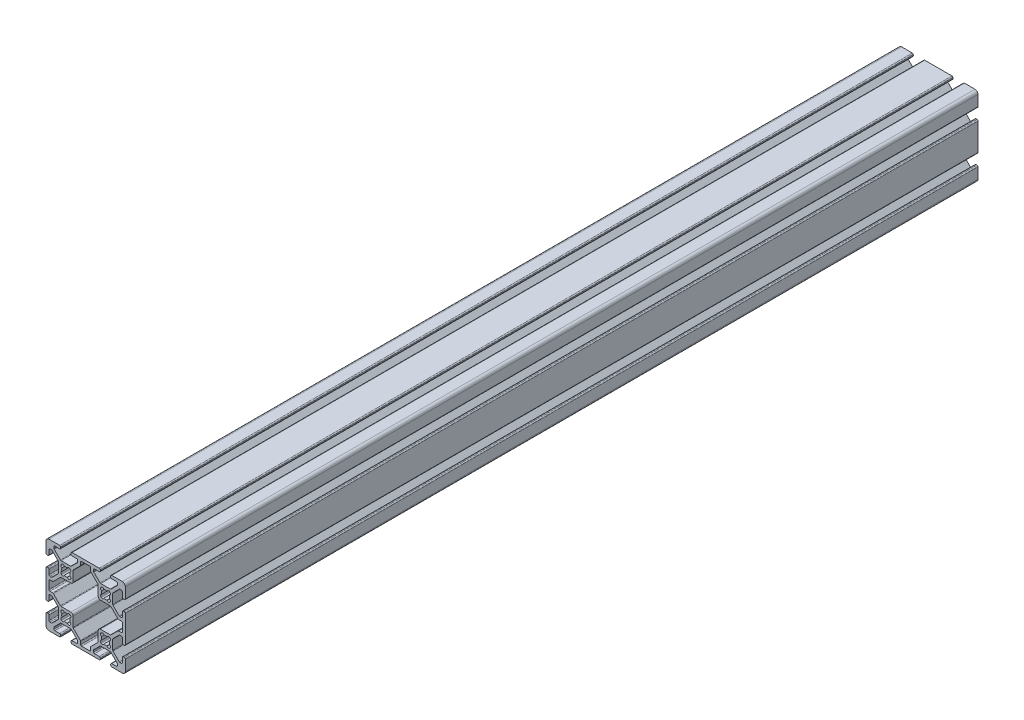
from build123d import *

# Parameters (mm, degrees)
EXTRUDE1_DEPTH = 430


with BuildPart() as part:
    # Sketch1 → Extrude1 (new body)
    with BuildSketch(Plane.XY):
        with BuildLine():
            Line((-22.383919339, -3.655), (-17.616080661, -3.655))
            ThreePointArc((-17.616080661, -3.655), (-17.421677478, -3.693669197), (-17.256870417, -3.803789755))
            Line((-17.256870417, -3.803789755), (-14.153789755, -6.906870417))
            ThreePointArc((-14.153789755, -6.906870417), (-14.043669197, -7.071677478), (-14.005, -7.266080661))
            Line((-14.005, -7.266080661), (-14.005, -7.992))
            ThreePointArc((-14.005, -7.992), (-14.153789755, -8.351210245), (-14.513, -8.5))
            Line((-14.513, -8.5), (-16.862, -8.5))
            ThreePointArc((-16.862, -8.5), (-17.221210245, -8.648789755), (-17.37, -9.008))
            Line((-17.37, -9.008), (-17.37, -9.492))
            ThreePointArc((-17.37, -9.492), (-17.221210245, -9.851210245), (-16.862, -10))
            Line((-16.862, -10), (-3.138, -10))
            ThreePointArc((-3.138, -10), (-2.778789755, -9.851210245), (-2.63, -9.492))
            Line((-2.63, -9.492), (-2.63, -9.008))
            ThreePointArc((-2.63, -9.008), (-2.778789755, -8.648789755), (-3.138, -8.5))
            Line((-3.138, -8.5), (-5.487, -8.5))
            ThreePointArc((-5.487, -8.5), (-5.846210245, -8.351210245), (-5.995, -7.992))
            Line((-5.995, -7.992), (-5.995, -7.266080661))
            ThreePointArc((-5.995, -7.266080661), (-5.956330803, -7.071677478), (-5.846210245, -6.906870417))
            Line((-5.846210245, -6.906870417), (-2.743129583, -3.803789755))
            ThreePointArc((-2.743129583, -3.803789755), (-2.578322522, -3.693669197), (-2.383919339, -3.655))
            Line((-2.383919339, -3.655), (2.383919339, -3.655))
            ThreePointArc((2.383919339, -3.655), (2.578322522, -3.693669197), (2.743129583, -3.803789755))
            Line((2.743129583, -3.803789755), (5.846210245, -6.906870417))
            ThreePointArc((5.846210245, -6.906870417), (5.956330803, -7.071677478), (5.995, -7.266080661))
            Line((5.995, -7.266080661), (5.995, -7.992))
            ThreePointArc((5.995, -7.992), (5.846210245, -8.351210245), (5.487, -8.5))
            Line((5.487, -8.5), (3.138, -8.5))
            ThreePointArc((3.138, -8.5), (2.778789755, -8.648789755), (2.63, -9.008))
            Line((2.63, -9.008), (2.63, -9.492))
            ThreePointArc((2.63, -9.492), (2.778789755, -9.851210245), (3.138, -10))
            Line((3.138, -10), (8.5, -10))
            ThreePointArc((8.5, -10), (9.560660172, -9.560660172), (10, -8.5))
            Line((10, -8.5), (10, -3.138))
            ThreePointArc((10, -3.138), (9.851210245, -2.778789755), (9.492, -2.63))
            Line((9.492, -2.63), (9.008, -2.63))
            ThreePointArc((9.008, -2.63), (8.648789755, -2.778789755), (8.5, -3.138))
            Line((8.5, -3.138), (8.5, -5.487))
            ThreePointArc((8.5, -5.487), (8.351210245, -5.846210245), (7.992, -5.995))
            Line((7.992, -5.995), (7.266080661, -5.995))
            ThreePointArc((7.266080661, -5.995), (7.071677478, -5.956330803), (6.906870417, -5.846210245))
            Line((6.906870417, -5.846210245), (3.803789755, -2.743129583))
            ThreePointArc((3.803789755, -2.743129583), (3.693669197, -2.578322522), (3.655, -2.383919339))
            Line((3.655, -2.383919339), (3.655, 2.383919339))
            ThreePointArc((3.655, 2.383919339), (3.693669197, 2.578322522), (3.803789755, 2.743129583))
            Line((3.803789755, 2.743129583), (6.906870417, 5.846210245))
            ThreePointArc((6.906870417, 5.846210245), (7.071677478, 5.956330803), (7.266080661, 5.995))
            Line((7.266080661, 5.995), (7.992, 5.995))
            ThreePointArc((7.992, 5.995), (8.351210245, 5.846210245), (8.5, 5.487))
            Line((8.5, 5.487), (8.5, 3.138))
            ThreePointArc((8.5, 3.138), (8.648789755, 2.778789755), (9.008, 2.63))
            Line((9.008, 2.63), (9.492, 2.63))
            ThreePointArc((9.492, 2.63), (9.851210245, 2.778789755), (10, 3.138))
            Line((10, 3.138), (10, 16.862))
            ThreePointArc((10, 16.862), (9.851210245, 17.221210245), (9.492, 17.37))
            Line((9.492, 17.37), (9.008, 17.37))
            ThreePointArc((9.008, 17.37), (8.648789755, 17.221210245), (8.5, 16.862))
            Line((8.5, 16.862), (8.5, 14.513))
            ThreePointArc((8.5, 14.513), (8.351210245, 14.153789755), (7.992, 14.005))
            Line((7.992, 14.005), (7.266080661, 14.005))
            ThreePointArc((7.266080661, 14.005), (7.071677478, 14.043669197), (6.906870417, 14.153789755))
            Line((6.906870417, 14.153789755), (3.803789755, 17.256870417))
            ThreePointArc((3.803789755, 17.256870417), (3.693669197, 17.421677478), (3.655, 17.616080661))
            Line((3.655, 17.616080661), (3.655, 22.383919339))
            ThreePointArc((3.655, 22.383919339), (3.693669197, 22.578322522), (3.803789755, 22.743129583))
            Line((3.803789755, 22.743129583), (6.906870417, 25.846210245))
            ThreePointArc((6.906870417, 25.846210245), (7.071677478, 25.956330803), (7.266080661, 25.995))
            Line((7.266080661, 25.995), (7.992, 25.995))
            ThreePointArc((7.992, 25.995), (8.351210245, 25.846210245), (8.5, 25.487))
            Line((8.5, 25.487), (8.5, 23.138))
            ThreePointArc((8.5, 23.138), (8.648789755, 22.778789755), (9.008, 22.63))
            Line((9.008, 22.63), (9.492, 22.63))
            ThreePointArc((9.492, 22.63), (9.851210245, 22.778789755), (10, 23.138))
            Line((10, 23.138), (10, 28.5))
            ThreePointArc((10, 28.5), (9.560660172, 29.560660172), (8.5, 30))
            Line((8.5, 30), (3.138, 30))
            ThreePointArc((3.138, 30), (2.778789755, 29.851210245), (2.63, 29.492))
            Line((2.63, 29.492), (2.63, 29.008))
            ThreePointArc((2.63, 29.008), (2.778789755, 28.648789755), (3.138, 28.5))
            Line((3.138, 28.5), (5.487, 28.5))
            ThreePointArc((5.487, 28.5), (5.846210245, 28.351210245), (5.995, 27.992))
            Line((5.995, 27.992), (5.995, 27.266080661))
            ThreePointArc((5.995, 27.266080661), (5.956330803, 27.071677478), (5.846210245, 26.906870417))
            Line((5.846210245, 26.906870417), (2.743129583, 23.803789755))
            ThreePointArc((2.743129583, 23.803789755), (2.578322522, 23.693669197), (2.383919339, 23.655))
            Line((2.383919339, 23.655), (-2.383919339, 23.655))
            ThreePointArc((-2.383919339, 23.655), (-2.578322522, 23.693669197), (-2.743129583, 23.803789755))
            Line((-2.743129583, 23.803789755), (-5.846210245, 26.906870417))
            ThreePointArc((-5.846210245, 26.906870417), (-5.956330803, 27.071677478), (-5.995, 27.266080661))
            Line((-5.995, 27.266080661), (-5.995, 27.992))
            ThreePointArc((-5.995, 27.992), (-5.846210245, 28.351210245), (-5.487, 28.5))
            Line((-5.487, 28.5), (-3.138, 28.5))
            ThreePointArc((-3.138, 28.5), (-2.778789755, 28.648789755), (-2.63, 29.008))
            Line((-2.63, 29.008), (-2.63, 29.492))
            ThreePointArc((-2.63, 29.492), (-2.778789755, 29.851210245), (-3.138, 30))
            Line((-3.138, 30), (-16.862, 30))
            ThreePointArc((-16.862, 30), (-17.221210245, 29.851210245), (-17.37, 29.492))
            Line((-17.37, 29.492), (-17.37, 29.008))
            ThreePointArc((-17.37, 29.008), (-17.221210245, 28.648789755), (-16.862, 28.5))
            Line((-16.862, 28.5), (-14.513, 28.5))
            ThreePointArc((-14.513, 28.5), (-14.153789755, 28.351210245), (-14.005, 27.992))
            Line((-14.005, 27.992), (-14.005, 27.266080661))
            ThreePointArc((-14.005, 27.266080661), (-14.043669197, 27.071677478), (-14.153789755, 26.906870417))
            Line((-14.153789755, 26.906870417), (-17.256870417, 23.803789755))
            ThreePointArc((-17.256870417, 23.803789755), (-17.421677478, 23.693669197), (-17.616080661, 23.655))
            Line((-17.616080661, 23.655), (-22.383919339, 23.655))
            ThreePointArc((-22.383919339, 23.655), (-22.578322522, 23.693669197), (-22.743129583, 23.803789755))
            Line((-22.743129583, 23.803789755), (-25.846210245, 26.906870417))
            ThreePointArc((-25.846210245, 26.906870417), (-25.956330803, 27.071677478), (-25.995, 27.266080661))
            Line((-25.995, 27.266080661), (-25.995, 27.992))
            ThreePointArc((-25.995, 27.992), (-25.846210245, 28.351210245), (-25.487, 28.5))
            Line((-25.487, 28.5), (-23.138, 28.5))
            ThreePointArc((-23.138, 28.5), (-22.778789755, 28.648789755), (-22.63, 29.008))
            Line((-22.63, 29.008), (-22.63, 29.492))
            ThreePointArc((-22.63, 29.492), (-22.778789755, 29.851210245), (-23.138, 30))
            Line((-23.138, 30), (-28.5, 30))
            ThreePointArc((-28.5, 30), (-29.560660172, 29.560660172), (-30, 28.5))
            Line((-30, 28.5), (-30, 23.138))
            ThreePointArc((-30, 23.138), (-29.851210245, 22.778789755), (-29.492, 22.63))
            Line((-29.492, 22.63), (-29.008, 22.63))
            ThreePointArc((-29.008, 22.63), (-28.648789755, 22.778789755), (-28.5, 23.138))
            Line((-28.5, 23.138), (-28.5, 25.487))
            ThreePointArc((-28.5, 25.487), (-28.351210245, 25.846210245), (-27.992, 25.995))
            Line((-27.992, 25.995), (-27.266080661, 25.995))
            ThreePointArc((-27.266080661, 25.995), (-27.071677478, 25.956330803), (-26.906870417, 25.846210245))
            Line((-26.906870417, 25.846210245), (-23.803789755, 22.743129583))
            ThreePointArc((-23.803789755, 22.743129583), (-23.693669197, 22.578322522), (-23.655, 22.383919339))
            Line((-23.655, 22.383919339), (-23.655, 17.616080661))
            ThreePointArc((-23.655, 17.616080661), (-23.693669197, 17.421677478), (-23.803789755, 17.256870417))
            Line((-23.803789755, 17.256870417), (-26.906870417, 14.153789755))
            ThreePointArc((-26.906870417, 14.153789755), (-27.071677478, 14.043669197), (-27.266080661, 14.005))
            Line((-27.266080661, 14.005), (-27.992, 14.005))
            ThreePointArc((-27.992, 14.005), (-28.351210245, 14.153789755), (-28.5, 14.513))
            Line((-28.5, 14.513), (-28.5, 16.862))
            ThreePointArc((-28.5, 16.862), (-28.648789755, 17.221210245), (-29.008, 17.37))
            Line((-29.008, 17.37), (-29.492, 17.37))
            ThreePointArc((-29.492, 17.37), (-29.851210245, 17.221210245), (-30, 16.862))
            Line((-30, 16.862), (-30, 3.138))
            ThreePointArc((-30, 3.138), (-29.851210245, 2.778789755), (-29.492, 2.63))
            Line((-29.492, 2.63), (-29.008, 2.63))
            ThreePointArc((-29.008, 2.63), (-28.648789755, 2.778789755), (-28.5, 3.138))
            Line((-28.5, 3.138), (-28.5, 5.487))
            ThreePointArc((-28.5, 5.487), (-28.351210245, 5.846210245), (-27.992, 5.995))
            Line((-27.992, 5.995), (-27.266080661, 5.995))
            ThreePointArc((-27.266080661, 5.995), (-27.071677478, 5.956330803), (-26.906870417, 5.846210245))
            Line((-26.906870417, 5.846210245), (-23.803789755, 2.743129583))
            ThreePointArc((-23.803789755, 2.743129583), (-23.693669197, 2.578322522), (-23.655, 2.383919339))
            Line((-23.655, 2.383919339), (-23.655, -2.383919339))
            ThreePointArc((-23.655, -2.383919339), (-23.693669197, -2.578322522), (-23.803789755, -2.743129583))
            Line((-23.803789755, -2.743129583), (-26.906870417, -5.846210245))
            ThreePointArc((-26.906870417, -5.846210245), (-27.071677478, -5.956330803), (-27.266080661, -5.995))
            Line((-27.266080661, -5.995), (-27.992, -5.995))
            ThreePointArc((-27.992, -5.995), (-28.351210245, -5.846210245), (-28.5, -5.487))
            Line((-28.5, -5.487), (-28.5, -3.138))
            ThreePointArc((-28.5, -3.138), (-28.648789755, -2.778789755), (-29.008, -2.63))
            Line((-29.008, -2.63), (-29.492, -2.63))
            ThreePointArc((-29.492, -2.63), (-29.851210245, -2.778789755), (-30, -3.138))
            Line((-30, -3.138), (-30, -8.5))
            ThreePointArc((-30, -8.5), (-29.560660172, -9.560660172), (-28.5, -10))
            Line((-28.5, -10), (-23.138, -10))
            ThreePointArc((-23.138, -10), (-22.778789755, -9.851210245), (-22.63, -9.492))
            Line((-22.63, -9.492), (-22.63, -9.008))
            ThreePointArc((-22.63, -9.008), (-22.778789755, -8.648789755), (-23.138, -8.5))
            Line((-23.138, -8.5), (-25.487, -8.5))
            ThreePointArc((-25.487, -8.5), (-25.846210245, -8.351210245), (-25.995, -7.992))
            Line((-25.995, -7.992), (-25.995, -7.266080661))
            ThreePointArc((-25.995, -7.266080661), (-25.956330803, -7.071677478), (-25.846210245, -6.906870417))
            Line((-25.846210245, -6.906870417), (-22.743129583, -3.803789755))
            ThreePointArc((-22.743129583, -3.803789755), (-22.578322522, -3.693669197), (-22.383919339, -3.655))
        make_face()
        with BuildLine():
            Line((-2.124900844, 17.695494034), (-2.304505966, 17.875099156))
            ThreePointArc((-2.304505966, 17.875099156), (-2.505938017, 18.643532189), (-1.935133506, 19.196023282))
            ThreePointArc((-1.935133506, 19.196023282), (-2.0955, 20), (-1.935133506, 20.803976718))
            ThreePointArc((-1.935133506, 20.803976718), (-2.505938017, 21.356467811), (-2.304505966, 22.124900844))
            Line((-2.304505966, 22.124900844), (-2.124900844, 22.304505966))
            ThreePointArc((-2.124900844, 22.304505966), (-1.356467811, 22.505938017), (-0.803976718, 21.935133506))
            ThreePointArc((-0.803976718, 21.935133506), (0, 22.0955), (0.803976718, 21.935133506))
            ThreePointArc((0.803976718, 21.935133506), (1.356467811, 22.505938017), (2.124900844, 22.304505966))
            Line((2.124900844, 22.304505966), (2.304505966, 22.124900844))
            ThreePointArc((2.304505966, 22.124900844), (2.505938017, 21.356467811), (1.935133506, 20.803976718))
            ThreePointArc((1.935133506, 20.803976718), (2.0955, 20), (1.935133506, 19.196023282))
            ThreePointArc((1.935133506, 19.196023282), (2.505938017, 18.643532189), (2.304505966, 17.875099156))
            Line((2.304505966, 17.875099156), (2.124900844, 17.695494034))
            ThreePointArc((2.124900844, 17.695494034), (1.356467811, 17.494061983), (0.803976718, 18.064866494))
            ThreePointArc((0.803976718, 18.064866494), (0, 17.9045), (-0.803976718, 18.064866494))
            ThreePointArc((-0.803976718, 18.064866494), (-1.356467811, 17.494061983), (-2.124900844, 17.695494034))
        make_face(mode=Mode.SUBTRACT)
        with BuildLine():
            Line((-22.124900844, 17.695494034), (-22.304505966, 17.875099156))
            ThreePointArc((-22.304505966, 17.875099156), (-22.505938017, 18.643532189), (-21.935133506, 19.196023282))
            ThreePointArc((-21.935133506, 19.196023282), (-22.0955, 20), (-21.935133506, 20.803976718))
            ThreePointArc((-21.935133506, 20.803976718), (-22.505938017, 21.356467811), (-22.304505966, 22.124900844))
            Line((-22.304505966, 22.124900844), (-22.124900844, 22.304505966))
            ThreePointArc((-22.124900844, 22.304505966), (-21.356467811, 22.505938017), (-20.803976718, 21.935133506))
            ThreePointArc((-20.803976718, 21.935133506), (-20, 22.0955), (-19.196023282, 21.935133506))
            ThreePointArc((-19.196023282, 21.935133506), (-18.643532189, 22.505938017), (-17.875099156, 22.304505966))
            Line((-17.875099156, 22.304505966), (-17.695494034, 22.124900844))
            ThreePointArc((-17.695494034, 22.124900844), (-17.494061983, 21.356467811), (-18.064866494, 20.803976718))
            ThreePointArc((-18.064866494, 20.803976718), (-17.9045, 20), (-18.064866494, 19.196023282))
            ThreePointArc((-18.064866494, 19.196023282), (-17.494061983, 18.643532189), (-17.695494034, 17.875099156))
            Line((-17.695494034, 17.875099156), (-17.875099156, 17.695494034))
            ThreePointArc((-17.875099156, 17.695494034), (-18.643532189, 17.494061983), (-19.196023282, 18.064866494))
            ThreePointArc((-19.196023282, 18.064866494), (-20, 17.9045), (-20.803976718, 18.064866494))
            ThreePointArc((-20.803976718, 18.064866494), (-21.356467811, 17.494061983), (-22.124900844, 17.695494034))
        make_face(mode=Mode.SUBTRACT)
        with BuildLine():
            Line((-2.124900844, -2.304505966), (-2.304505966, -2.124900844))
            ThreePointArc((-2.304505966, -2.124900844), (-2.505938017, -1.356467811), (-1.935133506, -0.803976718))
            ThreePointArc((-1.935133506, -0.803976718), (-2.0955, 0), (-1.935133506, 0.803976718))
            ThreePointArc((-1.935133506, 0.803976718), (-2.505938017, 1.356467811), (-2.304505966, 2.124900844))
            Line((-2.304505966, 2.124900844), (-2.124900844, 2.304505966))
            ThreePointArc((-2.124900844, 2.304505966), (-1.356467811, 2.505938017), (-0.803976718, 1.935133506))
            ThreePointArc((-0.803976718, 1.935133506), (0, 2.0955), (0.803976718, 1.935133506))
            ThreePointArc((0.803976718, 1.935133506), (1.356467811, 2.505938017), (2.124900844, 2.304505966))
            Line((2.124900844, 2.304505966), (2.304505966, 2.124900844))
            ThreePointArc((2.304505966, 2.124900844), (2.505938017, 1.356467811), (1.935133506, 0.803976718))
            ThreePointArc((1.935133506, 0.803976718), (2.0955, 0), (1.935133506, -0.803976718))
            ThreePointArc((1.935133506, -0.803976718), (2.505938017, -1.356467811), (2.304505966, -2.124900844))
            Line((2.304505966, -2.124900844), (2.124900844, -2.304505966))
            ThreePointArc((2.124900844, -2.304505966), (1.356467811, -2.505938017), (0.803976718, -1.935133506))
            ThreePointArc((0.803976718, -1.935133506), (0, -2.0955), (-0.803976718, -1.935133506))
            ThreePointArc((-0.803976718, -1.935133506), (-1.356467811, -2.505938017), (-2.124900844, -2.304505966))
        make_face(mode=Mode.SUBTRACT)
        with BuildLine():
            Line((-12.505, -7.992), (-12.505, -6.644760318))
            ThreePointArc((-12.505, -6.644760318), (-12.543669197, -6.450357134), (-12.653789755, -6.285550073))
            Line((-12.653789755, -6.285550073), (-16.196210245, -2.743129583))
            ThreePointArc((-16.196210245, -2.743129583), (-16.306330803, -2.578322522), (-16.345, -2.383919339))
            Line((-16.345, -2.383919339), (-16.345, 2.512))
            ThreePointArc((-16.345, 2.512), (-16.679776949, 3.320223051), (-17.488, 3.655))
            Line((-17.488, 3.655), (-22.383919339, 3.655))
            ThreePointArc((-22.383919339, 3.655), (-22.578322522, 3.693669197), (-22.743129583, 3.803789755))
            Line((-22.743129583, 3.803789755), (-26.285550073, 7.346210245))
            ThreePointArc((-26.285550073, 7.346210245), (-26.450357134, 7.456330803), (-26.644760318, 7.495))
            Line((-26.644760318, 7.495), (-27.992, 7.495))
            ThreePointArc((-27.992, 7.495), (-28.351210245, 7.643789755), (-28.5, 8.003))
            Line((-28.5, 8.003), (-28.5, 11.997))
            ThreePointArc((-28.5, 11.997), (-28.351210245, 12.356210245), (-27.992, 12.505))
            Line((-27.992, 12.505), (-26.644760318, 12.505))
            ThreePointArc((-26.644760318, 12.505), (-26.450357134, 12.543669197), (-26.285550073, 12.653789755))
            Line((-26.285550073, 12.653789755), (-22.743129583, 16.196210245))
            ThreePointArc((-22.743129583, 16.196210245), (-22.578322522, 16.306330803), (-22.383919339, 16.345))
            Line((-22.383919339, 16.345), (-17.488, 16.345))
            ThreePointArc((-17.488, 16.345), (-16.679776949, 16.679776949), (-16.345, 17.488))
            Line((-16.345, 17.488), (-16.345, 22.383919339))
            ThreePointArc((-16.345, 22.383919339), (-16.306330803, 22.578322522), (-16.196210245, 22.743129583))
            Line((-16.196210245, 22.743129583), (-12.653789755, 26.285550073))
            ThreePointArc((-12.653789755, 26.285550073), (-12.543669197, 26.450357134), (-12.505, 26.644760318))
            Line((-12.505, 26.644760318), (-12.505, 27.992))
            ThreePointArc((-12.505, 27.992), (-12.356210245, 28.351210245), (-11.997, 28.5))
            Line((-11.997, 28.5), (-8.003, 28.5))
            ThreePointArc((-8.003, 28.5), (-7.643789755, 28.351210245), (-7.495, 27.992))
            Line((-7.495, 27.992), (-7.495, 26.644760318))
            ThreePointArc((-7.495, 26.644760318), (-7.456330803, 26.450357134), (-7.346210245, 26.285550073))
            Line((-7.346210245, 26.285550073), (-3.803789755, 22.743129583))
            ThreePointArc((-3.803789755, 22.743129583), (-3.693669197, 22.578322522), (-3.655, 22.383919339))
            Line((-3.655, 22.383919339), (-3.655, 17.488))
            ThreePointArc((-3.655, 17.488), (-3.320223051, 16.679776949), (-2.512, 16.345))
            Line((-2.512, 16.345), (2.383919339, 16.345))
            ThreePointArc((2.383919339, 16.345), (2.578322522, 16.306330803), (2.743129583, 16.196210245))
            Line((2.743129583, 16.196210245), (6.285550073, 12.653789755))
            ThreePointArc((6.285550073, 12.653789755), (6.450357134, 12.543669197), (6.644760318, 12.505))
            Line((6.644760318, 12.505), (7.992, 12.505))
            ThreePointArc((7.992, 12.505), (8.351210245, 12.356210245), (8.5, 11.997))
            Line((8.5, 11.997), (8.5, 8.003))
            ThreePointArc((8.5, 8.003), (8.351210245, 7.643789755), (7.992, 7.495))
            Line((7.992, 7.495), (6.644760318, 7.495))
            ThreePointArc((6.644760318, 7.495), (6.450357134, 7.456330803), (6.285550073, 7.346210245))
            Line((6.285550073, 7.346210245), (2.743129583, 3.803789755))
            ThreePointArc((2.743129583, 3.803789755), (2.578322522, 3.693669197), (2.383919339, 3.655))
            Line((2.383919339, 3.655), (-2.512, 3.655))
            ThreePointArc((-2.512, 3.655), (-3.320223051, 3.320223051), (-3.655, 2.512))
            Line((-3.655, 2.512), (-3.655, -2.383919339))
            ThreePointArc((-3.655, -2.383919339), (-3.693669197, -2.578322522), (-3.803789755, -2.743129583))
            Line((-3.803789755, -2.743129583), (-7.346210245, -6.285550073))
            ThreePointArc((-7.346210245, -6.285550073), (-7.456330803, -6.450357134), (-7.495, -6.644760318))
            Line((-7.495, -6.644760318), (-7.495, -7.992))
            ThreePointArc((-7.495, -7.992), (-7.643789755, -8.351210245), (-8.003, -8.5))
            Line((-8.003, -8.5), (-11.997, -8.5))
            ThreePointArc((-11.997, -8.5), (-12.356210245, -8.351210245), (-12.505, -7.992))
        make_face(mode=Mode.SUBTRACT)
        with BuildLine():
            Line((-22.124900844, -2.304505966), (-22.304505966, -2.124900844))
            ThreePointArc((-22.304505966, -2.124900844), (-22.505938017, -1.356467811), (-21.935133506, -0.803976718))
            ThreePointArc((-21.935133506, -0.803976718), (-22.0955, 0), (-21.935133506, 0.803976718))
            ThreePointArc((-21.935133506, 0.803976718), (-22.505938017, 1.356467811), (-22.304505966, 2.124900844))
            Line((-22.304505966, 2.124900844), (-22.124900844, 2.304505966))
            ThreePointArc((-22.124900844, 2.304505966), (-21.356467811, 2.505938017), (-20.803976718, 1.935133506))
            ThreePointArc((-20.803976718, 1.935133506), (-20, 2.0955), (-19.196023282, 1.935133506))
            ThreePointArc((-19.196023282, 1.935133506), (-18.643532189, 2.505938017), (-17.875099156, 2.304505966))
            Line((-17.875099156, 2.304505966), (-17.695494034, 2.124900844))
            ThreePointArc((-17.695494034, 2.124900844), (-17.494061983, 1.356467811), (-18.064866494, 0.803976718))
            ThreePointArc((-18.064866494, 0.803976718), (-17.9045, 0), (-18.064866494, -0.803976718))
            ThreePointArc((-18.064866494, -0.803976718), (-17.494061983, -1.356467811), (-17.695494034, -2.124900844))
            Line((-17.695494034, -2.124900844), (-17.875099156, -2.304505966))
            ThreePointArc((-17.875099156, -2.304505966), (-18.643532189, -2.505938017), (-19.196023282, -1.935133506))
            ThreePointArc((-19.196023282, -1.935133506), (-20, -2.0955), (-20.803976718, -1.935133506))
            ThreePointArc((-20.803976718, -1.935133506), (-21.356467811, -2.505938017), (-22.124900844, -2.304505966))
        make_face(mode=Mode.SUBTRACT)
    extrude(amount=-EXTRUDE1_DEPTH)


solid = part.part
